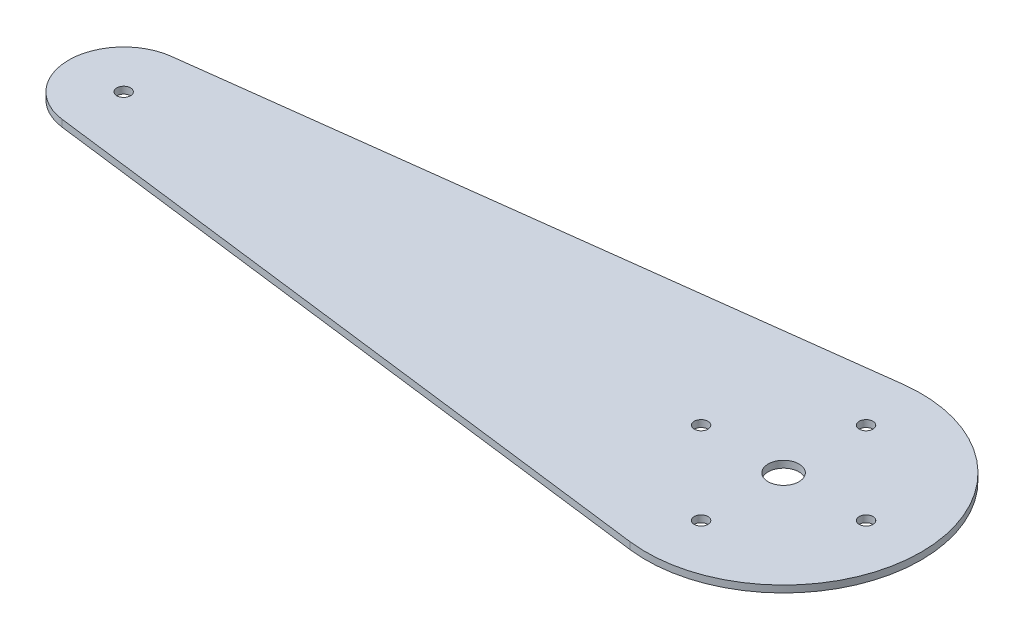
from build123d import *

# Parameters (mm, degrees)
SKETCH1_R           = 1.5875
SKETCH1_R_2         = 3.556
BOSS_EXTRUDE1_DEPTH = 1.5875


with BuildPart() as part:
    # Sketch1 → Boss-Extrude1 (new body)
    with BuildSketch(Plane(origin=(0, 0, 0), x_dir=(1, 0, 0), z_dir=(0, 1, 0))):
        with BuildLine():
            Line((-153.9875, 12.600390619), (-3.96875, 31.500976547))
            ThreePointArc((-3.96875, 31.500976547), (31.75, 0), (-3.96875, -31.500976547))
            Line((-3.96875, -31.500976547), (-153.9875, -12.600390619))
            ThreePointArc((-153.9875, -12.600390619), (-165.1, 0), (-153.9875, 12.600390619))
        make_face()
        with Locations((-152.4, 0)):
            Circle(SKETCH1_R, mode=Mode.SUBTRACT)
        Circle(SKETCH1_R_2, mode=Mode.SUBTRACT)
        with Locations((0, 19.05)):
            Circle(SKETCH1_R, mode=Mode.SUBTRACT)
        with Locations((19.05, 0)):
            Circle(SKETCH1_R, mode=Mode.SUBTRACT)
        with Locations((0, -19.05)):
            Circle(SKETCH1_R, mode=Mode.SUBTRACT)
        with Locations((-19.05, 0)):
            Circle(SKETCH1_R, mode=Mode.SUBTRACT)
    extrude(amount=BOSS_EXTRUDE1_DEPTH)


solid = part.part
